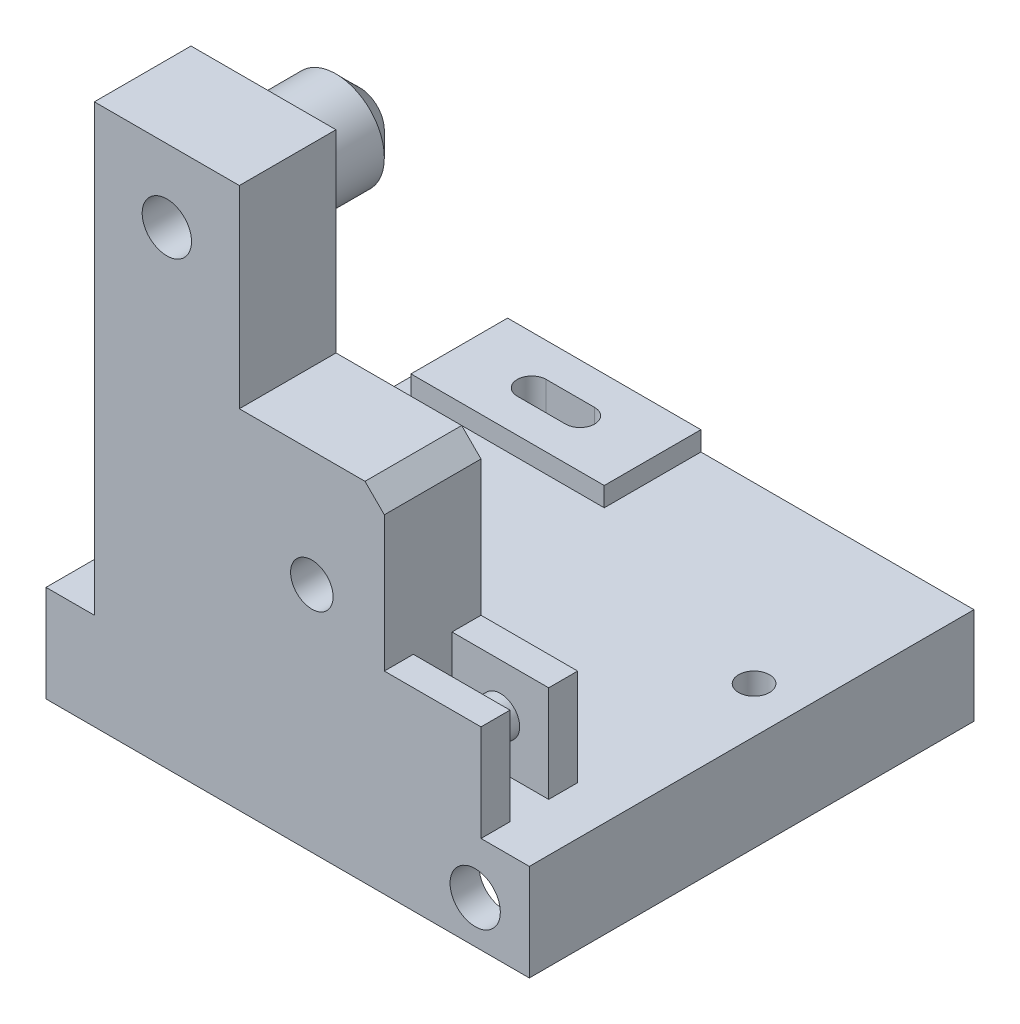
from build123d import *

# Parameters (mm, degrees)
BOSS_EXTRUDE1_DEPTH      = 6
BOSS_EXTRUDE1_DEPTH_BACK = 4
SKETCH1_R                = 2.55
SKETCH1_R_2              = 2.2
SKETCH4_W                = 10
SKETCH4_H                = 10
BOSS_EXTRUDE4_DEPTH      = 10
SKETCH5_W                = 4
SKETCH5_H                = 10
CUT_EXTRUDE1_DEPTH       = 10
BOSS_EXTRUDE5_REACH      = 54.82
SKETCH6_R                = 2
CHAMFER1_SIZE            = 2
SKETCH7_W                = 50
SKETCH7_H                = 20.5
BOSS_EXTRUDE6_DEPTH      = 10
SKETCH13_W               = 50
SKETCH13_H               = 10
BOSS_EXTRUDE9_DEPTH      = 25.5
SKETCH16_W               = 44
SKETCH16_H               = 40
CUT_EXTRUDE3_DEPTH       = 7
SKETCH17_R               = 2.6
CUT_EXTRUDE4_DEPTH       = 3
SKETCH18_W               = 2
SKETCH18_H               = 10
BOSS_EXTRUDE11_DEPTH     = 5
FILLET2_R                = 5
CUT_EXTRUDE5_REACH       = 67.666
SKETCH20_R               = 2.55
FILLET5_R                = 1.5
CUT_EXTRUDE6_DEPTH       = 3
BOSS_EXTRUDE12_START     = 2
SKETCH22_W               = 20
SKETCH22_H               = 10
BOSS_EXTRUDE12_DEPTH     = 2
CUT_EXTRUDE7_REACH       = 69.941
SKETCH23_R               = 1.6
CUT_EXTRUDE8_DEPTH       = 68.941151006


with BuildPart() as part:
    # Sketch1 → Boss-Extrude1 (new, two sides: drawn at the far end of the back side and taken through both)
    with BuildSketch(Plane.XY.offset(-BOSS_EXTRUDE1_DEPTH_BACK)):
        Polygon((-15, 0), (-15, 46), (0, 46), (0, 26), (15, 26), (15, 0), align=None)
        with Locations((-7.5, 38.5)):
            Circle(SKETCH1_R, mode=Mode.SUBTRACT)
        with Locations((7.5, 14)):
            Circle(SKETCH1_R_2, mode=Mode.SUBTRACT)
    extrude(amount=BOSS_EXTRUDE1_DEPTH + BOSS_EXTRUDE1_DEPTH_BACK)

    # Sketch4 → Boss-Extrude4 (add)
    with BuildSketch(Plane(origin=(0, 0, -4), x_dir=(-1, 0, 0), z_dir=(0, 0, -1))):
        with Locations((-20, 5)):
            Rectangle(SKETCH4_W, SKETCH4_H)
    extrude(amount=-BOSS_EXTRUDE4_DEPTH)

    # Sketch5 → Cut-Extrude1 (cut)
    with BuildSketch(Plane(origin=(25, 0, 0), x_dir=(0, 0, -1), z_dir=(1, 0, 0))):
        with Locations((-1, 5)):
            Rectangle(SKETCH5_W, SKETCH5_H)
    extrude(amount=-CUT_EXTRUDE1_DEPTH, mode=Mode.SUBTRACT)

    # Sketch6 → Boss-Extrude5 (add, up to next)
    with BuildSketch(Plane.XY.offset(-1), mode=Mode.PRIVATE) as boss_extrude5_sk1:
        with Locations(Location((20, 5, 0), (0, 0, 90))):
            Circle(SKETCH6_R)
    boss_extrude5_tool1 = extrude(boss_extrude5_sk1.sketch, amount=BOSS_EXTRUDE5_REACH, mode=Mode.PRIVATE) - part.part
    add(boss_extrude5_tool1.solids().sort_by_distance((20, 5, -1))[0])

    # Chamfer1
    chamfer1_edges = [part.edges().sort_by_distance(p)[0] for p in [
        (15, 26, 1),
    ]]
    chamfer(chamfer1_edges, length=CHAMFER1_SIZE)

    # Sketch7 → Boss-Extrude6 (add)
    with BuildSketch(Plane.XZ):
        with Locations((5, -4.25)):
            Rectangle(SKETCH7_W, SKETCH7_H)
    extrude(amount=BOSS_EXTRUDE6_DEPTH)

    # Sketch13 → Boss-Extrude9 (add)
    with BuildSketch(Plane(origin=(0, 0, -14.5), x_dir=(-1, 0, 0), z_dir=(0, 0, -1))):
        with Locations((-5, -5)):
            Rectangle(SKETCH13_W, SKETCH13_H)
    extrude(amount=BOSS_EXTRUDE9_DEPTH)

    # Sketch16 → Cut-Extrude3 (cut)
    with BuildSketch(Plane.XZ.offset(10)):
        with Locations((5, -17)):
            Rectangle(SKETCH16_W, SKETCH16_H)
    extrude(amount=-CUT_EXTRUDE3_DEPTH, mode=Mode.SUBTRACT)

    # Sketch17 → Cut-Extrude4 (cut)
    with BuildSketch(Plane.XY.offset(6)):
        with Locations((24.4, -5.6)):
            Circle(SKETCH17_R)
    extrude(amount=-CUT_EXTRUDE4_DEPTH, mode=Mode.SUBTRACT)

    # Sketch18 → Boss-Extrude11 (add)
    with BuildSketch(Plane.ZY.offset(20)):
        with Locations((-10, -5)):
            Rectangle(SKETCH18_W, SKETCH18_H)
    extrude(amount=BOSS_EXTRUDE11_DEPTH)

    # Fillet2
    fillet2_edges = [part.edges().sort_by_distance(p)[0] for p in [
        (-20, -5, -11),
    ]]
    fillet(fillet2_edges, radius=FILLET2_R - 0.0001)  # a hair under: the kernel refuses the full size

    # Sketch19 → Revolve1 (revolve)
    with BuildSketch(Plane.ZY.offset(7.5), mode=Mode.PRIVATE) as revolve1_sk:
        Polygon((-4, 38.5), (-14, 38.5), (-14, 41), (-11.5, 43.5), (-4, 43.5), align=None)
    revolve(revolve1_sk.sketch.rotate(Axis((-7.5, 38.5, -4), (0, 0, -1)), 90), axis=Axis((-7.5, 38.5, -4), (0, 0, -1)))

    # Sketch20 → Cut-Extrude5 (cut, up to next)
    with BuildSketch(Plane.XY.offset(-4), mode=Mode.PRIVATE) as cut_extrude5_sk1:
        with Locations((-7.5, 38.5)):
            Circle(SKETCH20_R)
    cut_extrude5_tool1 = extrude(cut_extrude5_sk1.sketch, amount=-CUT_EXTRUDE5_REACH, mode=Mode.PRIVATE) & part.part
    add(cut_extrude5_tool1.solids().sort_by_distance((-7.5, 38.5, -4))[0], mode=Mode.SUBTRACT)

    # Fillet5
    fillet5_edges = [part.edges().sort_by_distance(p)[0] for p in [
        (-12.5, 38.5, -4),
    ]]
    fillet(fillet5_edges, radius=FILLET5_R)

    # Sketch12 → Cut-Extrude6 (cut)
    with BuildSketch(Plane(origin=(0, 0, 0), x_dir=(1, 0, 0), z_dir=(0, 1, 0))):
        with BuildLine():
            Line((-10.75, 10.5), (-5.75, 10.5))
            ThreePointArc((-5.75, 10.5), (-4.25, 9), (-5.75, 7.5))
            Line((-5.75, 7.5), (-10.75, 7.5))
            ThreePointArc((-10.75, 7.5), (-12.25, 9), (-10.75, 10.5))
        make_face()
    extrude(amount=-CUT_EXTRUDE6_DEPTH, mode=Mode.SUBTRACT)

    # Sketch22 → Boss-Extrude12 (add)
    # profile 1 of 2: a face of its own
    with BuildSketch(Plane(origin=(0, 0, 0), x_dir=(1, 0, 0), z_dir=(0, 1, 0)).offset(BOSS_EXTRUDE12_START)):
        with Locations((-8.25, 9)):
            Rectangle(SKETCH22_W, SKETCH22_H)
        with BuildLine():
            Line((-10.75, 7.5), (-5.75, 7.5))
            ThreePointArc((-5.75, 7.5), (-4.25, 9), (-5.75, 10.5))
            Line((-5.75, 10.5), (-10.75, 10.5))
            ThreePointArc((-10.75, 10.5), (-12.25, 9), (-10.75, 7.5))
        make_face(mode=Mode.SUBTRACT)
    # profile 2 of 2: a face of its own
    with BuildSketch(Plane(origin=(0, 0, 0), x_dir=(1, 0, 0), z_dir=(0, 1, 0)).offset(BOSS_EXTRUDE12_START)):
        with Locations((-8.25, 35)):
            Rectangle(SKETCH22_W, SKETCH22_H)
        with BuildLine():
            Line((-10.75, 36.5), (-5.75, 36.5))
            ThreePointArc((-5.75, 36.5), (-4.25, 35), (-5.75, 33.5))
            Line((-5.75, 33.5), (-10.75, 33.5))
            ThreePointArc((-10.75, 33.5), (-12.25, 35), (-10.75, 36.5))
        make_face(mode=Mode.SUBTRACT)
    extrude(amount=-BOSS_EXTRUDE12_DEPTH)

    # Sketch23 → Cut-Extrude7 (cut, up to next)
    with BuildSketch(Plane(origin=(0, 0, 0), x_dir=(1, 0, 0), z_dir=(0, 1, 0)), mode=Mode.PRIVATE) as cut_extrude7_sk1:
        with Locations(Location((25.25, 22, 0), (0, 0, 180))):
            Circle(SKETCH23_R)
    cut_extrude7_tool1 = extrude(cut_extrude7_sk1.sketch, amount=-CUT_EXTRUDE7_REACH, mode=Mode.PRIVATE) & part.part
    add(cut_extrude7_tool1.solids().sort_by_distance((25.25, 0, -22))[0], mode=Mode.SUBTRACT)

    # Sketch24 → Cut-Extrude8 (cut, through all)
    with BuildSketch(Plane(origin=(0, 0, 0), x_dir=(1, 0, 0), z_dir=(0, 1, 0))):
        with BuildLine():
            Line((-10.75, 33.5), (-5.75, 33.5))
            ThreePointArc((-5.75, 33.5), (-4.25, 35), (-5.75, 36.5))
            Line((-5.75, 36.5), (-10.75, 36.5))
            ThreePointArc((-10.75, 36.5), (-12.25, 35), (-10.75, 33.5))
        make_face()
    extrude(amount=-CUT_EXTRUDE8_DEPTH, mode=Mode.SUBTRACT)


solid = part.part
